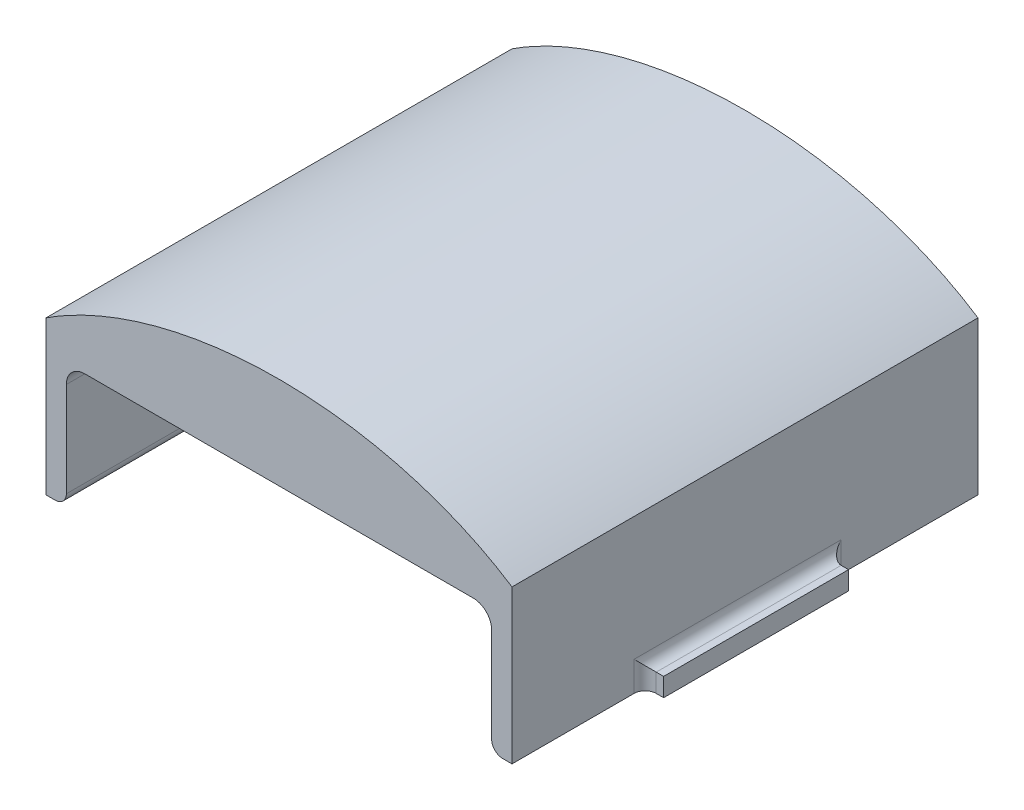
from build123d import *

# Parameters (mm, degrees)
SKETCH1_RX              = 22.86
SKETCH1_RY              = 15.24
BOSS_EXTRUDE4_DEPTH     = 45.72
CUT_EXTRUDE2_START      = -10.16
SKETCH4_W               = 29.21
SKETCH4_H               = 17.78
CUT_EXTRUDE2_DEPTH      = 33.02
CUT_EXTRUDE4_DEPTH      = 33.02
CUT_EXTRUDE4_DEPTH_BACK = 33.02
SKETCH7_W               = 14.643913221
SKETCH7_H               = 35.56
SKETCH8_R               = 1.75
CUT_EXTRUDE5_DEPTH      = 1.27
SKETCH9_R               = 0.5
CUT_EXTRUDE7_DEPTH      = 2.794
FILLET1_R               = 1.27
FILLET2_R               = 1.27
SKETCH10_W              = 45.72
SKETCH10_H              = 17.78
CUT_EXTRUDE8_DEPTH      = 47.972834865
CUT_EXTRUDE10_DEPTH     = 47.972834865
SKETCH15_W              = 29.21
SKETCH15_H              = 0.508
CUT_EXTRUDE13_DEPTH     = 42.866874941
SKETCH16_W              = 32.004
SKETCH16_H              = 0.3556
CUT_EXTRUDE14_DEPTH     = 39.891871036
BOSS_EXTRUDE5_START     = -10.16
SKETCH17_W              = 1.27
SKETCH17_H              = 1.27
BOSS_EXTRUDE5_DEPTH     = 12.7
FILLET3_R               = 0.762
FILLET4_R               = 0.762
FILLET5_R               = 0.762
FILLET6_R               = 1.27


with BuildPart() as part:
    # Sketch1 → Boss-Extrude4 (new body)
    with BuildSketch(Plane.XY):
        with Locations(Location((0, 0), (0, 0, 180))):
            Ellipse(SKETCH1_RX, SKETCH1_RY)
    extrude(amount=BOSS_EXTRUDE4_DEPTH)

    # Sketch4 → Cut-Extrude2 (cut)
    with BuildSketch(Plane.XY.offset(45.72).offset(CUT_EXTRUDE2_START)):
        Rectangle(SKETCH4_W, SKETCH4_H)
    extrude(amount=-CUT_EXTRUDE2_DEPTH, mode=Mode.SUBTRACT)

    # Sketch7 → Cut-Extrude4 (cut, two sides: drawn at the far end of the back side and taken through both)
    with BuildSketch(Plane(origin=(0, 0, 0), x_dir=(0, 0, -1), z_dir=(1, 0, 0)).offset(-CUT_EXTRUDE4_DEPTH_BACK)):
        with Locations((-45.421956611, -1.677648267)):
            Rectangle(SKETCH7_W, SKETCH7_H)
    extrude(amount=CUT_EXTRUDE4_DEPTH + CUT_EXTRUDE4_DEPTH_BACK, mode=Mode.SUBTRACT)

    # Sketch8 → Cut-Extrude5 (cut)
    with BuildSketch(Plane.XY):
        Circle(SKETCH8_R)
        with Locations((4.064, 0)):
            Circle(SKETCH8_R)
        with Locations((-4.064, 0)):
            Circle(SKETCH8_R)
    extrude(amount=CUT_EXTRUDE5_DEPTH, mode=Mode.SUBTRACT)

    # Sketch9 → Cut-Extrude7 (cut)
    with BuildSketch(Plane(origin=(0, 0, 0), x_dir=(-1, 0, 0), z_dir=(0, 0, -1))):
        with Locations((0, 0.8)):
            Circle(SKETCH9_R)
        with Locations((0, -0.8)):
            Circle(SKETCH9_R)
        with Locations((-4.064, 0.8)):
            Circle(SKETCH9_R)
        with Locations((-4.064, -0.8)):
            Circle(SKETCH9_R)
        with Locations((4.064, 0.8)):
            Circle(SKETCH9_R)
        with Locations((4.064, -0.8)):
            Circle(SKETCH9_R)
    extrude(amount=-CUT_EXTRUDE7_DEPTH, mode=Mode.SUBTRACT)

    # Fillet1
    fillet1_edges = [part.edges().sort_by_distance(p)[0] for p in [
        (22.859987041, 0.016227247, 0),
    ]]
    fillet(fillet1_edges, radius=FILLET1_R)

    # Fillet2
    fillet2_edges = [part.edges().sort_by_distance(p)[0] for p in [
        (22.860000074, 1.7e-08, 38.1),
    ]]
    fillet(fillet2_edges, radius=FILLET2_R)

    # Sketch10 → Cut-Extrude8 (cut, through all)
    with BuildSketch(Plane(origin=(0, 0, 0), x_dir=(-1, 0, 0), z_dir=(0, 0, -1))):
        with Locations((0, -8.89)):
            Rectangle(SKETCH10_W, SKETCH10_H)
    extrude(amount=-CUT_EXTRUDE8_DEPTH, mode=Mode.SUBTRACT)

    # Sketch13 → Cut-Extrude10 (cut, through all)
    with BuildSketch(Plane.XZ):
        with BuildLine():
            Line((-1.75, 1.27), (1.75, 1.27))
            Line((1.75, 1.27), (1.75, 0))
            Line((1.75, 0), (2.314, 0))
            Line((2.314, 0), (2.314, 1.27))
            Line((2.314, 1.27), (5.814, 1.27))
            Line((5.814, 1.27), (5.814, 0))
            Line((5.814, 0), (21.59, 0))
            ThreePointArc((21.59, 0), (22.488025612, 0.371974388), (22.86, 1.27))
            Line((22.86, 1.27), (22.86, 36.83))
            ThreePointArc((22.86, 36.83), (22.488025612, 37.728025612), (21.59, 38.1))
            Line((21.59, 38.1), (-21.59, 38.1))
            ThreePointArc((-21.59, 38.1), (-22.488025612, 37.728025612), (-22.86, 36.83))
            Line((-22.86, 36.83), (-22.86, 1.27))
            ThreePointArc((-22.86, 1.27), (-22.488025612, 0.371974388), (-21.59, 0))
            Line((-21.59, 0), (-5.814, 0))
            Line((-5.814, 0), (-5.814, 1.27))
            Line((-5.814, 1.27), (-2.314, 1.27))
            Line((-2.314, 1.27), (-2.314, 0))
            Line((-2.314, 0), (-1.75, 0))
            Line((-1.75, 0), (-1.75, 1.27))
        make_face()
        Polygon((16.002, 35.052), (16.002, 3.048), (14.605, 3.048), (14.605, 2.54), (-14.605, 2.54), (-14.605, 3.048), (-16.002, 3.048), (-16.002, 35.052), (-14.605, 35.052), (-14.605, 35.56), (14.605, 35.56), (14.605, 35.052), align=None, mode=Mode.SUBTRACT)
    extrude(amount=-CUT_EXTRUDE10_DEPTH, mode=Mode.SUBTRACT)


with BuildPart() as cut_extrude10_kept_piece:
    # of the separate pieces the step leaves, the one the design keeps (cut_extrude10_pieces_kept)
    add(part.part.solids().sort_by_distance((14.605, 11.724117119, 3.048))[0])

    # Sketch15 → Cut-Extrude13 (cut, through all)
    with BuildSketch(Plane(origin=(0, 0, 0), x_dir=(1, 0, 0), z_dir=(0, 1, 0))):
        with Locations((0, -2.794)):
            Rectangle(SKETCH15_W, SKETCH15_H)
        with Locations((0, -35.306)):
            Rectangle(SKETCH15_W, SKETCH15_H)
    extrude(amount=CUT_EXTRUDE13_DEPTH, mode=Mode.SUBTRACT)

    # Sketch16 → Cut-Extrude14 (cut, through all)
    with BuildSketch(Plane(origin=(0, 0, 3.048), x_dir=(-1, 0, 0), z_dir=(0, 0, -1))):
        with Locations((0, 0.1778)):
            Rectangle(SKETCH16_W, SKETCH16_H)
    extrude(amount=-CUT_EXTRUDE14_DEPTH, mode=Mode.SUBTRACT)

    # Sketch17 → Boss-Extrude5 (add)
    with BuildSketch(Plane(origin=(0, 0, 3.048), x_dir=(-1, 0, 0), z_dir=(0, 0, -1)).offset(BOSS_EXTRUDE5_START)):
        with Locations((-16.637, 0.9906)):
            Rectangle(SKETCH17_W, SKETCH17_H)
        with Locations((16.637, 0.9906)):
            Rectangle(SKETCH17_W, SKETCH17_H)
    extrude(amount=-BOSS_EXTRUDE5_DEPTH)

    # Fillet3
    fillet3_edges = [cut_extrude10_kept_piece.edges().sort_by_distance(p)[0] for p in [
        (16.002, 0.9906, 13.208),
        (16.002, 0.9906, 25.908),
        (16.002, 1.6256, 19.558),
    ]]
    fillet(fillet3_edges, radius=FILLET3_R)

    # Fillet4
    fillet4_edges = [cut_extrude10_kept_piece.edges().sort_by_distance(p)[0] for p in [
        (-16.002, 0.9906, 13.208),
        (-16.002, 1.6256, 19.558),
        (-16.002, 0.9906, 25.908),
    ]]
    fillet(fillet4_edges, radius=FILLET4_R)

    # Fillet5
    fillet5_edges = [cut_extrude10_kept_piece.edges().sort_by_distance(p)[0] for p in [
        (14.605, 0.3556, 19.05),
        (-14.605, 0.3556, 19.05),
    ]]
    fillet(fillet5_edges, radius=FILLET5_R)

    # Fillet6
    fillet6_edges = [cut_extrude10_kept_piece.edges().sort_by_distance(p)[0] for p in [
        (-14.605, 8.89, 19.05),
        (14.605, 8.89, 19.05),
    ]]
    fillet(fillet6_edges, radius=FILLET6_R)


solid = cut_extrude10_kept_piece.part
